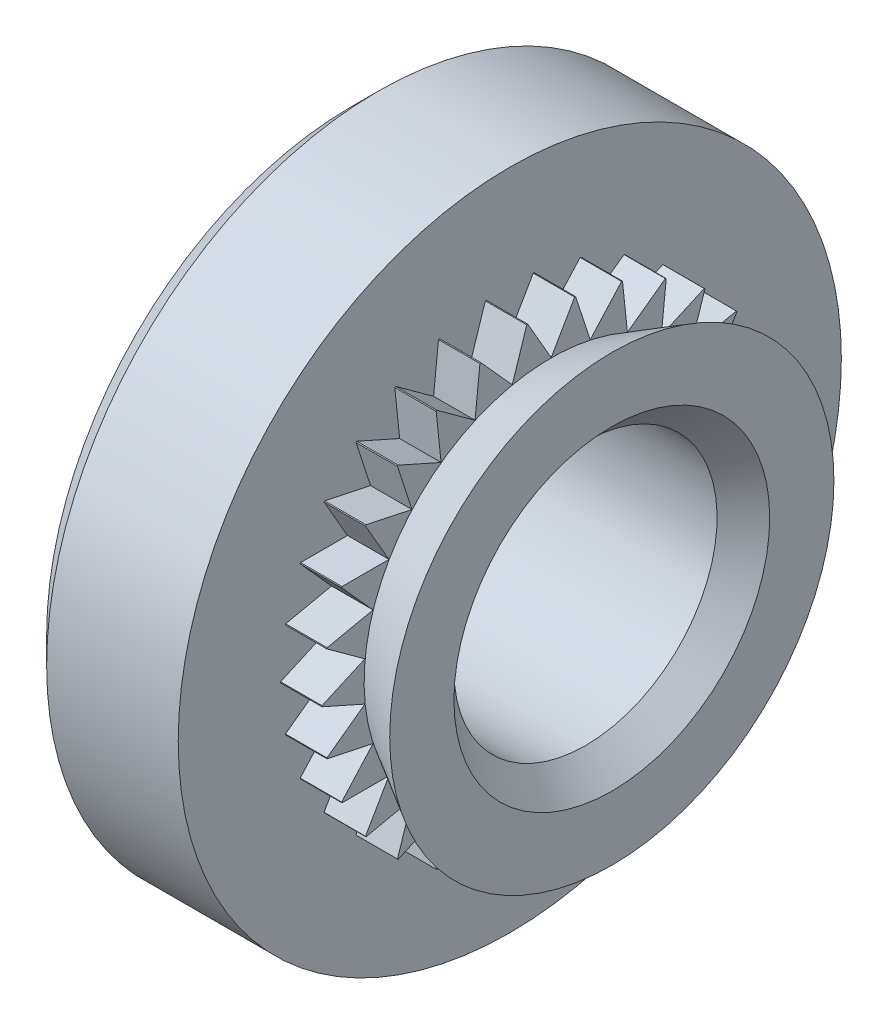
from build123d import *

# Parameters (mm, degrees)
CUT_EXTRUDE_1_DEPTH      = 0.393521224
PATTERN_START            = 1.5
PATTERN_CIRCULAR_1_DEPTH = 0.393521224
HOLE_WIZARD_M31_D        = 2.5
HOLE_WIZARD_M31_DEPTH    = 8.5
HOLE_WIZARD_M31_TIP      = 0.751075774
CHAMFER_3_SIZE           = 0.25
CHAMFER_4_SIZE           = 0.25


# Read off the part's stored shape, not the designer's step: Круговой массив1
with BuildPart() as part:
    # Эскиз1 → Повернуть1 (revolve)
    with BuildSketch(Plane.XY, mode=Mode.PRIVATE) as revolve_1_sk:
        Polygon((0, 0), (0, 3.15), (1.5, 3.15), (1.5, 2.177572634), (1.893521224, 2.177572634), (1.893521224, 1.777572634), (2.469302313, 2.11), (2.469302313, 0), align=None)
    revolve(revolve_1_sk.sketch.rotate(Axis((0, 0, 0), (1, 0, 0)), 180), axis=Axis((0, 0, 0), (1, 0, 0)))

    # Эскиз2 → Вырез-Вытянуть1 (cut)
    with BuildSketch(Plane(origin=(1.893521224, 0, 0), x_dir=(0, 0, -1), z_dir=(1, 0, 0))):
        with BuildLine():
            Line((0, 1.78), (-0.222932839, 2.166131003))
            ThreePointArc((-0.222932839, 2.166131003), (0, 2.177572634), (0.222932839, 2.166131003))
            Line((0.222932839, 2.166131003), (0, 1.78))
        make_face()
    extrude(amount=-CUT_EXTRUDE_1_DEPTH, mode=Mode.SUBTRACT)

    # Круговой массив1 outline → Круговой массив1 (cut)
    with BuildSketch(Plane.YZ.offset(PATTERN_START)):
        with BuildLine():
            Line((-0.89, -1.987390896), (-0.89, -1.541525219))
            Line((-0.89, -1.541525219), (-1.276131004, -1.764458058))
            ThreePointArc((-1.276131004, -1.764458058), (-1.088786317, -1.885833219), (-0.89, -1.987390896))
        make_face()
        with BuildLine():
            Line((1.741102729, -0.37008281), (2.0724455, -0.668425181))
            ThreePointArc((2.0724455, -0.668425181), (2.129987447, -0.452742808), (2.165146187, -0.232302738))
            Line((2.165146187, -0.232302738), (1.741102729, -0.37008281))
        make_face()
        with BuildLine():
            Line((1.626110915, -0.723991225), (1.888184184, -1.084704135))
            ThreePointArc((1.888184184, -1.084704135), (1.989311588, -0.885698583), (2.069534093, -0.677385571))
            Line((2.069534093, -0.677385571), (1.626110915, -0.723991225))
        make_face()
        with BuildLine():
            Line((1.44005025, -1.046257749), (1.621400159, -1.453576313))
            ThreePointArc((1.621400159, -1.453576313), (1.761693267, -1.279945079), (1.883473429, -1.092863403))
            Line((1.883473429, -1.092863403), (1.44005025, -1.046257749))
        make_face()
        with BuildLine():
            Line((1.191052479, -1.322797789), (1.283753166, -1.758920232))
            ThreePointArc((1.283753166, -1.758920232), (1.457080496, -1.618251835), (1.615095937, -1.460577861))
            Line((1.615095937, -1.460577861), (1.191052479, -1.322797789))
        make_face()
        with BuildLine():
            Line((0.89, -1.541525219), (0.89, -1.987390896))
            ThreePointArc((0.89, -1.987390896), (1.088786317, -1.885833219), (1.276131003, -1.764458057))
            Line((1.276131003, -1.764458057), (0.89, -1.541525219))
        make_face()
        with BuildLine():
            Line((0.55005025, -1.692880599), (0.457349563, -2.129003042))
            ThreePointArc((0.457349563, -2.129003042), (0.67290695, -2.070994643), (0.881393021, -1.99122297))
            Line((0.881393021, -1.99122297), (0.55005025, -1.692880599))
        make_face()
        with BuildLine():
            Line((0.186060665, -1.770248974), (0.004710756, -2.177567538))
            ThreePointArc((0.004710756, -2.177567538), (0.227618321, -2.165643663), (0.448133934, -2.130961884))
            Line((0.448133934, -2.130961884), (0.186060665, -1.770248974))
        make_face()
        with BuildLine():
            Line((-0.186060665, -1.770248974), (-0.448133934, -2.130961884))
            ThreePointArc((-0.448133934, -2.130961884), (-0.227618321, -2.165643663), (-0.004710756, -2.177567538))
            Line((-0.004710756, -2.177567538), (-0.186060665, -1.770248974))
        make_face()
        with BuildLine():
            Line((-0.55005025, -1.692880599), (-0.881393021, -1.99122297))
            ThreePointArc((-0.881393021, -1.99122297), (-0.67290695, -2.070994643), (-0.457349563, -2.129003042))
            Line((-0.457349563, -2.129003042), (-0.55005025, -1.692880599))
        make_face()
        with BuildLine():
            ThreePointArc((2.165146187, 0.232302738), (2.129987447, 0.452742808), (2.0724455, 0.668425181))
            Line((2.0724455, 0.668425181), (1.741102729, 0.37008281))
            Line((1.741102729, 0.37008281), (2.165146187, 0.232302738))
        make_face()
        with BuildLine():
            ThreePointArc((2.069534093, 0.677385571), (1.989311588, 0.885698583), (1.888184184, 1.084704135))
            Line((1.888184184, 1.084704135), (1.626110915, 0.723991225))
            Line((1.626110915, 0.723991225), (2.069534093, 0.677385571))
        make_face()
        with BuildLine():
            ThreePointArc((1.883473429, 1.092863403), (1.761693267, 1.279945079), (1.621400159, 1.453576313))
            Line((1.621400159, 1.453576313), (1.44005025, 1.046257749))
            Line((1.44005025, 1.046257749), (1.883473429, 1.092863403))
        make_face()
        with BuildLine():
            ThreePointArc((1.615095937, 1.460577861), (1.457080496, 1.618251835), (1.283753166, 1.758920232))
            Line((1.283753166, 1.758920232), (1.191052479, 1.322797789))
            Line((1.191052479, 1.322797789), (1.615095937, 1.460577861))
        make_face()
        with BuildLine():
            ThreePointArc((1.276131003, 1.764458057), (1.088786317, 1.885833219), (0.89, 1.987390896))
            Line((0.89, 1.987390896), (0.89, 1.541525219))
            Line((0.89, 1.541525219), (1.276131003, 1.764458057))
        make_face()
        with BuildLine():
            ThreePointArc((0.881393021, 1.99122297), (0.67290695, 2.070994643), (0.457349563, 2.129003042))
            Line((0.457349563, 2.129003042), (0.55005025, 1.692880599))
            Line((0.55005025, 1.692880599), (0.881393021, 1.99122297))
        make_face()
        with BuildLine():
            ThreePointArc((0.448133934, 2.130961884), (0.227618321, 2.165643663), (0.004710756, 2.177567538))
            Line((0.004710756, 2.177567538), (0.186060665, 1.770248974))
            Line((0.186060665, 1.770248974), (0.448133934, 2.130961884))
        make_face()
        with BuildLine():
            ThreePointArc((-0.004710756, 2.177567538), (-0.227618321, 2.165643663), (-0.448133934, 2.130961884))
            Line((-0.448133934, 2.130961884), (-0.186060665, 1.770248974))
            Line((-0.186060665, 1.770248974), (-0.004710756, 2.177567538))
        make_face()
        with BuildLine():
            ThreePointArc((-0.457349563, 2.129003042), (-0.67290695, 2.070994643), (-0.881393021, 1.99122297))
            Line((-0.881393021, 1.99122297), (-0.55005025, 1.692880599))
            Line((-0.55005025, 1.692880599), (-0.457349563, 2.129003042))
        make_face()
        with BuildLine():
            ThreePointArc((-0.89, 1.987390896), (-1.088786317, 1.885833219), (-1.276131004, 1.764458058))
            Line((-1.276131004, 1.764458058), (-0.89, 1.541525219))
            Line((-0.89, 1.541525219), (-0.89, 1.987390896))
        make_face()
        with BuildLine():
            ThreePointArc((-1.283753166, 1.758920232), (-1.457080497, 1.618251835), (-1.615095937, 1.460577861))
            Line((-1.615095937, 1.460577861), (-1.191052479, 1.322797789))
            Line((-1.191052479, 1.322797789), (-1.283753166, 1.758920232))
        make_face()
        with BuildLine():
            ThreePointArc((-1.621400159, 1.453576313), (-1.761693268, 1.27994508), (-1.883473429, 1.092863403))
            Line((-1.883473429, 1.092863403), (-1.44005025, 1.046257749))
            Line((-1.44005025, 1.046257749), (-1.621400159, 1.453576313))
        make_face()
        with BuildLine():
            ThreePointArc((-1.888184185, 1.084704135), (-1.989311588, 0.885698583), (-2.069534094, 0.677385571))
            Line((-2.069534094, 0.677385571), (-1.626110915, 0.723991225))
            Line((-1.626110915, 0.723991225), (-1.888184185, 1.084704135))
        make_face()
        with BuildLine():
            ThreePointArc((-2.072445501, 0.668425181), (-2.129987447, 0.452742808), (-2.165146188, 0.232302738))
            Line((-2.165146188, 0.232302738), (-1.741102729, 0.37008281))
            Line((-1.741102729, 0.37008281), (-2.072445501, 0.668425181))
        make_face()
        with BuildLine():
            ThreePointArc((-2.166131004, 0.222932839), (-2.177572634, 0), (-2.166131004, -0.222932839))
            Line((-2.166131004, -0.222932839), (-1.78, 0))
            Line((-1.78, 0), (-2.166131004, 0.222932839))
        make_face()
        with BuildLine():
            ThreePointArc((-2.165146188, -0.232302738), (-2.129987447, -0.452742808), (-2.072445501, -0.668425181))
            Line((-2.072445501, -0.668425181), (-1.741102729, -0.37008281))
            Line((-1.741102729, -0.37008281), (-2.165146188, -0.232302738))
        make_face()
        with BuildLine():
            ThreePointArc((-2.069534094, -0.677385571), (-1.989311588, -0.885698583), (-1.888184185, -1.084704135))
            Line((-1.888184185, -1.084704135), (-1.626110915, -0.723991225))
            Line((-1.626110915, -0.723991225), (-2.069534094, -0.677385571))
        make_face()
        with BuildLine():
            ThreePointArc((-1.883473429, -1.092863403), (-1.761693268, -1.27994508), (-1.621400159, -1.453576313))
            Line((-1.621400159, -1.453576313), (-1.44005025, -1.046257749))
            Line((-1.44005025, -1.046257749), (-1.883473429, -1.092863403))
        make_face()
        with BuildLine():
            ThreePointArc((-1.615095937, -1.460577861), (-1.457080497, -1.618251835), (-1.283753166, -1.758920232))
            Line((-1.283753166, -1.758920232), (-1.191052479, -1.322797789))
            Line((-1.191052479, -1.322797789), (-1.615095937, -1.460577861))
        make_face()
    extrude(amount=PATTERN_CIRCULAR_1_DEPTH, mode=Mode.SUBTRACT)

    # Отверстие обработанное метчиком M31
    with Locations(Plane.ZY):
        with Locations((0, 0)):
            Hole(HOLE_WIZARD_M31_D / 2, depth=HOLE_WIZARD_M31_DEPTH)
            with Locations((0, 0, -(HOLE_WIZARD_M31_DEPTH + HOLE_WIZARD_M31_TIP / 2))):  # 118° drill point
                Cone(0, HOLE_WIZARD_M31_D / 2, HOLE_WIZARD_M31_TIP, mode=Mode.SUBTRACT)

    # Фаска3
    chamfer_3_edges = [part.edges().sort_by_distance(p)[0] for p in [
        (2.469302313, 0, 1.25),
    ]]
    chamfer(chamfer_3_edges, length=CHAMFER_3_SIZE)

    # Фаска4
    chamfer_4_edges = [part.edges().sort_by_distance(p)[0] for p in [
        (0, 3.15, 0),
    ]]
    chamfer(chamfer_4_edges, length=CHAMFER_4_SIZE)


solid = part.part
